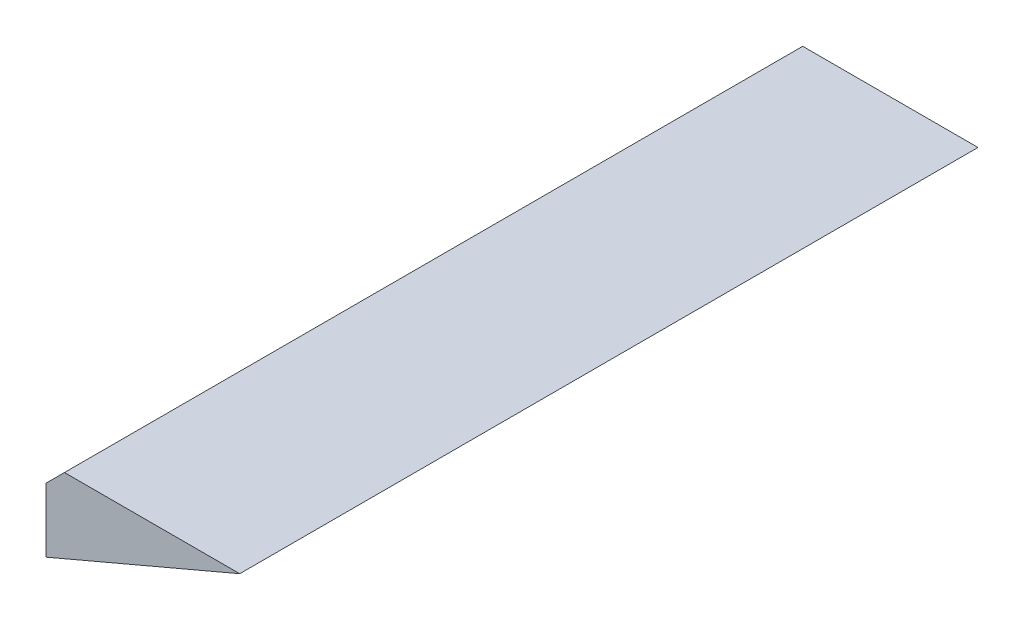
from build123d import *

# Parameters (mm, degrees)
AUFSATZ_LINEAR_AUSTRAGEN1_DEPTH = 200
FASE1_SIZE                      = 5


with BuildPart() as part:
    # Skizze1 → Aufsatz-Linear austragen1 (new body)
    with BuildSketch(Plane.XY):
        Polygon((-188.551604042, 146.626566289), (-188.551604042, 124.272982641), (-136.069277217, 146.626566289), align=None)
    extrude(amount=AUFSATZ_LINEAR_AUSTRAGEN1_DEPTH)

    # Fase1
    fase1_edges = [part.edges().sort_by_distance(p)[0] for p in [
        (-188.551604042, 146.626566289, 100),
    ]]
    chamfer(fase1_edges, length=FASE1_SIZE)


solid = part.part
